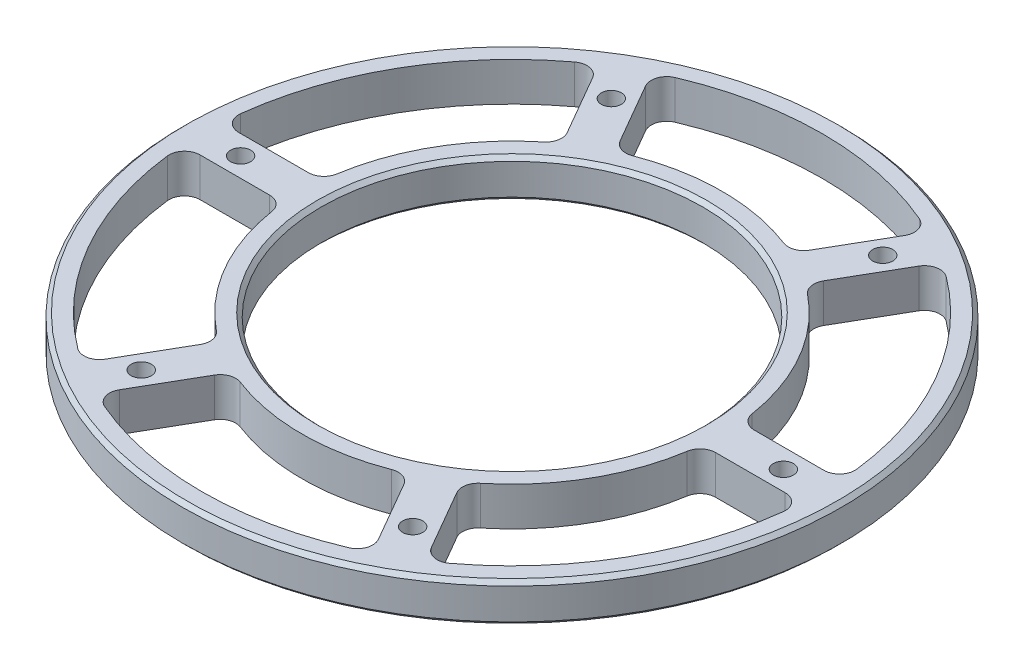
from build123d import *

# Parameters (mm, degrees)
SKETCH2_W                  = 35.78733
SKETCH2_H                  = 10
F_6_0_204_DIAMETER_HOLE1_D = 5.1816
CIRPATTERN3_COUNT          = 6
CUT_EXTRUDE1_DEPTH         = 121.623141229
FILLET1_R                  = 4
CIRPATTERN4_COUNT          = 6
FILLET1_OF_CIRPATTERN4_R   = 4
CHAMFER1_SIZE              = 1
CHAMFER2_SIZE              = 1


with BuildPart() as part:
    # Sketch2 → Revolve1 (revolve)
    with BuildSketch(Plane(origin=(0, 0, 0), x_dir=(0, 0, -1), z_dir=(1, 0, 0))):
        with Locations((-67.106165, 5)):
            Rectangle(SKETCH2_W, SKETCH2_H)
    revolve(axis=Axis((0, -0.5, 0), (0, 1, 0)))

    # #6 (0.204) Diameter Hole1 (through all)
    with Locations(Plane(origin=(0, 10, 0), x_dir=(1, 0, 0), z_dir=(0, 1, 0))):
        with Locations((-35, 60.621778265)):
            f_6_0_204_diameter_hole1 = Hole(F_6_0_204_DIAMETER_HOLE1_D / 2)

    # CirPattern3: #6 (0.204) Diameter Hole1 ×6 about axis
    cirpattern3_axis = Axis((0, -0.5, 0), (0, 1, 0))
    for i in range(1, CIRPATTERN3_COUNT):
        add(f_6_0_204_diameter_hole1.rotate(cirpattern3_axis, i * 360 / CIRPATTERN3_COUNT), mode=Mode.SUBTRACT)

    # Sketch8 → Cut-Extrude1 (cut, through all)
    with BuildSketch(Plane(origin=(0, 10, 0), x_dir=(1, 0, 0), z_dir=(0, 1, 0))):
        with BuildLine():
            Line((-22.660589701, 49.249292692), (-35.591586371, 71.646435917))
            ThreePointArc((-35.591586371, 71.646435917), (0, 79.99983), (35.591586371, 71.646435917))
            Line((35.591586371, 71.646435917), (22.660589701, 49.249292692))
            ThreePointArc((22.660589701, 49.249292692), (0, 54.2125), (-22.660589701, 49.249292692))
        make_face()
    cut_extrude1 = extrude(amount=-CUT_EXTRUDE1_DEPTH, mode=Mode.SUBTRACT)

    # Fillet1
    fillet1_edges = [part.edges().sort_by_distance(p)[0] for p in [
        (-22.660589701, 5, -49.249292692),
        (22.660589701, 5, -49.249292692),
        (35.591586371, 5, -71.646435917),
        (-35.591586371, 5, -71.646435917),
    ]]
    fillet(fillet1_edges, radius=FILLET1_R)

    # CirPattern4: Cut-Extrude1 ×6 about axis
    cirpattern4_axis = Axis((0, -0.5, 0), (0, 1, 0))
    for i in range(1, CIRPATTERN4_COUNT):
        add(cut_extrude1.rotate(cirpattern4_axis, i * 360 / CIRPATTERN4_COUNT), mode=Mode.SUBTRACT)

    # Fillet1 of CirPattern4
    fillet1_of_cirpattern4_edges = [part.edges().sort_by_distance(p)[0] for p in [
        (-53.98143344, 5, -5),
        (-31.320843739, 5, -44.249292692),
        (-44.251840409, 5, -66.646435917),
        (-79.84342678, 5, -5),
        (-31.320843739, 5, 44.249292692),
        (-53.98143344, 5, 5),
        (-79.84342678, 5, 5),
        (-44.251840409, 5, 66.646435917),
        (22.660589701, 5, 49.249292692),
        (-22.660589701, 5, 49.249292692),
        (-35.591586371, 5, 71.646435917),
        (35.591586371, 5, 71.646435917),
        (53.98143344, 5, 5),
        (31.320843739, 5, 44.249292692),
        (44.251840409, 5, 66.646435917),
        (79.84342678, 5, 5),
        (31.320843739, 5, -44.249292692),
        (53.98143344, 5, -5),
        (79.84342678, 5, -5),
        (44.251840409, 5, -66.646435917),
    ]]
    fillet(fillet1_of_cirpattern4_edges, radius=FILLET1_OF_CIRPATTERN4_R)

    # Chamfer1
    chamfer1_edges = [part.edges().sort_by_distance(p)[0] for p in [
        (0, 10, -49.2125),
        (0, 0, -49.2125),
    ]]
    chamfer(chamfer1_edges, length=CHAMFER1_SIZE)

    # Chamfer2
    chamfer2_edges = [part.edges().sort_by_distance(p)[0] for p in [
        (0, 10, -84.99983),
        (0, 0, -84.99983),
    ]]
    chamfer(chamfer2_edges, length=CHAMFER2_SIZE)


solid = part.part
